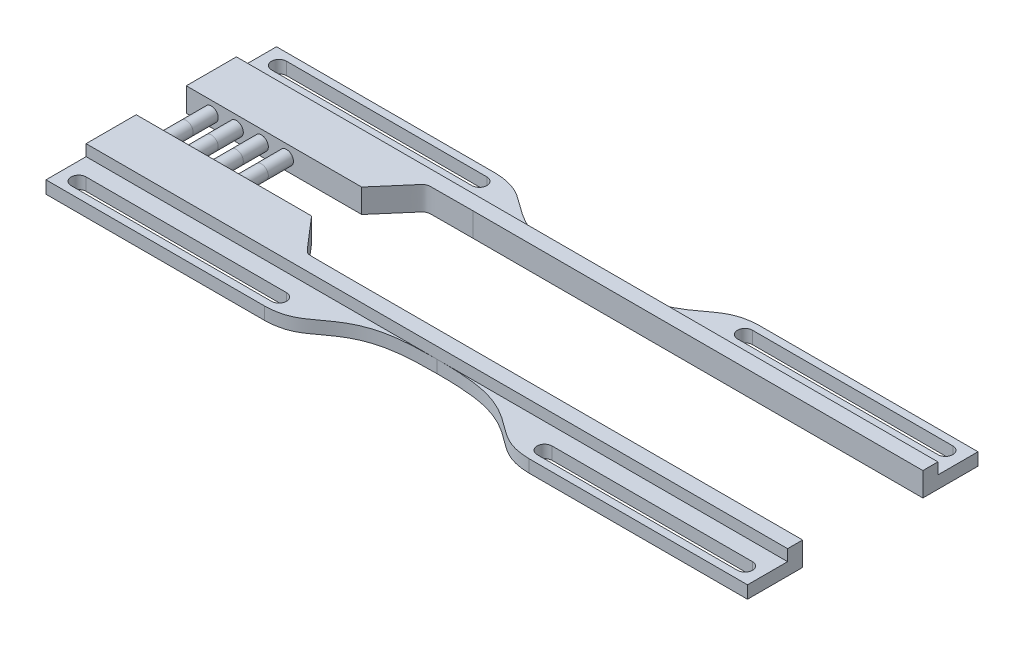
from build123d import *

# Parameters (mm, degrees)
ESBO_O1_W                = 15
ESBO_O1_H                = 4.75
RESSALTO_EXTRUS_O1_DEPTH = 140
ESBO_O3_W                = 105
ESBO_O3_H                = 7
CORTE_EXTRUS_O1_DEPTH    = 30
SKETCH1_W                = 188.959516426
SKETCH1_H                = 16.492662785
CUT_EXTRUDE2_DEPTH       = 10
SKETCH2_W                = 140
SKETCH2_H                = 8
BOSS_EXTRUDE1_DEPTH      = 2.5
CUT_EXTRUDE4_DEPTH       = 2.5
SKETCH6_R                = 1.375
BOSS_EXTRUDE2_DEPTH      = 5
FILLET1_START            = -2.375
FILLET1_DEPTH            = 4.75
CUT_EXTRUDE6_DEPTH       = 10


with BuildPart() as part:
    # Esboço1 → Ressalto-extrusão1 (new body)
    with BuildSketch(Plane(origin=(0, 0, 0), x_dir=(0, 0, -1), z_dir=(1, 0, 0))):
        with Locations((-7.5, 0)):
            Rectangle(ESBO_O1_W, ESBO_O1_H)
    extrude(amount=RESSALTO_EXTRUS_O1_DEPTH)

    # Esboço3 → Corte-extrusão1 (cut)
    with BuildSketch(Plane(origin=(0, 2.375, 0), x_dir=(1, 0, 0), z_dir=(0, 1, 0))):
        with Locations((87.5, -8.5)):
            Rectangle(ESBO_O3_W, ESBO_O3_H)
    extrude(amount=-CORTE_EXTRUS_O1_DEPTH, mode=Mode.SUBTRACT)

    # Sketch1 → Cut-Extrude2 (cut)
    with BuildSketch(Plane(origin=(0, 2.375, 0), x_dir=(1, 0, 0), z_dir=(0, 1, 0))):
        with Locations((94.479758213, 3.246331393)):
            Rectangle(SKETCH1_W, SKETCH1_H)
    extrude(amount=-CUT_EXTRUDE2_DEPTH, mode=Mode.SUBTRACT)

    # Sketch2 → Boss-Extrude1 (add)
    with BuildSketch(Plane.XZ.offset(2.375)):
        with Locations((70, 19)):
            Rectangle(SKETCH2_W, SKETCH2_H)
    extrude(amount=-BOSS_EXTRUDE1_DEPTH)

    # Sketch5 → Cut-Extrude4 (cut)
    with BuildSketch(Plane(origin=(0, 0.125, 0), x_dir=(1, 0, 0), z_dir=(0, 1, 0))):
        with BuildLine():
            Line((3.5, -18.5), (43.5, -18.5))
            ThreePointArc((43.5, -18.5), (45, -20), (43.5, -21.5))
            Line((43.5, -21.5), (3.5, -21.5))
            ThreePointArc((3.5, -21.5), (2, -20), (3.5, -18.5))
        make_face()
        with BuildLine():
            Line((136.5, -18.5), (96.5, -18.5))
            ThreePointArc((96.5, -18.5), (95, -20), (96.5, -21.5))
            Line((96.5, -21.5), (136.5, -21.5))
            ThreePointArc((136.5, -21.5), (138, -20), (136.5, -18.5))
        make_face()
    extrude(amount=-CUT_EXTRUDE4_DEPTH, mode=Mode.SUBTRACT)

    # Sketch6 → Boss-Extrude2 (add)
    with BuildSketch(Plane(origin=(0, 0, 5), x_dir=(-1, 0, 0), z_dir=(0, 0, -1))):
        with Locations(Location((-5, 0, 0), (0, 0, 270))):
            Circle(SKETCH6_R)
        with Locations(Location((-10, 0, 0), (0, 0, 270))):
            Circle(SKETCH6_R)
        with Locations(Location((-15, 0, 0), (0, 0, 270))):
            Circle(SKETCH6_R)
        with Locations(Location((-20, 0, 0), (0, 0, 270))):
            Circle(SKETCH6_R)
    extrude(amount=BOSS_EXTRUDE2_DEPTH)

    # Fillet1: read off the stored shape, not the designer's step
    # Fillet1 outline → Fillet1 (add)
    with BuildSketch(Plane(origin=(0, 0, 0), x_dir=(1, 0, 0), z_dir=(0, 1, 0)).offset(FILLET1_START)):
        with BuildLine():
            Line((140, -15), (140, -12))
            Line((140, -12), (50.198684154, -12))
            add(Edge.make_bspline(
                [(35, -5), (40.987360424, -12), (50.198684154, -12)],
                knots=[0, 0, 0, 1, 1, 1], degree=2, weights=[1, 18.165902125, 1]))
            Line((35, -5), (0, -5))
            Line((0, -5), (0, -15))
            Line((0, -15), (140, -15))
        make_face()
    extrude(amount=FILLET1_DEPTH)

    # Sketch7 → Cut-Extrude6 (cut)
    with BuildSketch(Plane(origin=(0, 0.125, 0), x_dir=(1, 0, 0), z_dir=(0, 1, 0))):
        with BuildLine():
            Line((96.34538631, -23), (43.65461369, -23))
            add(Edge.make_bspline(
                [(43.65461369, -23), (47.439098753, -22.914801017), (50.029093998, -21.120313708), (56.766609415, -16.011533513), (61.343326446, -14.978583727), (70, -15)],
                knots=[0, 0, 0, 0, 0.239896962, 0.339896962, 1, 1, 1, 1], degree=3))
            add(Edge.make_bspline(
                [(96.34538631, -23), (92.560901247, -22.914801017), (89.970906002, -21.120313708), (83.233390585, -16.011533513), (78.656673554, -14.978583727), (70, -15)],
                knots=[0, 0, 0, 0, 0.239896962, 0.339896962, 1, 1, 1, 1], degree=3))
        make_face()
    extrude(amount=-CUT_EXTRUDE6_DEPTH, mode=Mode.SUBTRACT)


with BuildPart() as body_2:
    # Mirror1: mirrored copy
    add(part.part.mirror(Plane(origin=(5, 0, 0), x_dir=(1, 0, 0), z_dir=(0, 0, -1))))


solid = Compound([part.part, body_2.part])
